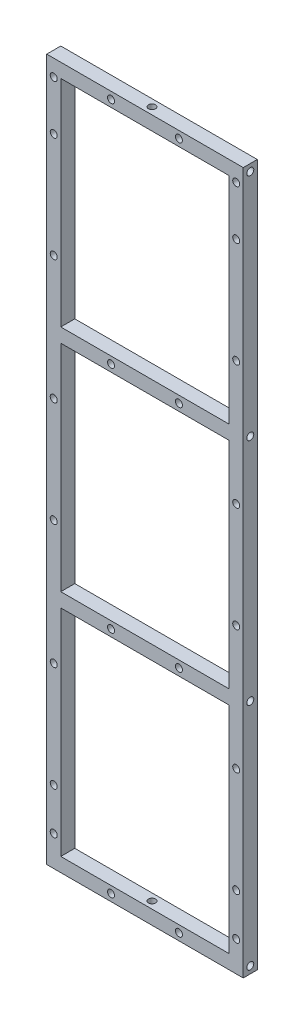
from build123d import *

# Parameters (mm, degrees)
SKETCH1_W           = 84
SKETCH1_H           = 300
SKETCH1_W_2         = 72
SKETCH1_H_2         = 92
BOSS_EXTRUDE1_DEPTH = 6
SKETCH2_R           = 1.5
CUT_EXTRUDE1_DEPTH  = 10
SKETCH3_R           = 1.5
CUT_EXTRUDE2_DEPTH  = 10
SKETCH4_R           = 1.5
CUT_EXTRUDE3_DEPTH  = 10
SKETCH5_R           = 1.5
CUT_EXTRUDE4_DEPTH  = 10


with BuildPart() as part:
    # Sketch1 → Boss-Extrude1 (new body)
    with BuildSketch(Plane.XY):
        Rectangle(SKETCH1_W, SKETCH1_H)
        with Locations((0, 98)):
            Rectangle(SKETCH1_W_2, SKETCH1_H_2, mode=Mode.SUBTRACT)
        with Locations((0, -98)):
            Rectangle(SKETCH1_W_2, SKETCH1_H_2, mode=Mode.SUBTRACT)
        Rectangle(SKETCH1_W_2, SKETCH1_H_2, mode=Mode.SUBTRACT)
    extrude(amount=BOSS_EXTRUDE1_DEPTH)

    # Sketch2 → Cut-Extrude1 (cut)
    with BuildSketch(Plane(origin=(42, 0, 0), x_dir=(0, 0, -1), z_dir=(1, 0, 0))):
        with Locations((-3, 147)):
            Circle(SKETCH2_R)
        with Locations((-3, 49)):
            Circle(SKETCH2_R)
        with Locations((-3, -49)):
            Circle(SKETCH2_R)
        with Locations((-3, -147)):
            Circle(SKETCH2_R)
    cut_extrude1 = extrude(amount=-CUT_EXTRUDE1_DEPTH, mode=Mode.SUBTRACT)

    # Mirror1: Cut-Extrude1 across plane
    add(cut_extrude1.mirror(Plane(origin=(0, 0, 0), x_dir=(0, 0, 1), z_dir=(1, 0, 0))), mode=Mode.SUBTRACT)

    # Sketch3 → Cut-Extrude2 (cut)
    with BuildSketch(Plane.XY.offset(6)):
        with Locations((-39, 143)):
            Circle(SKETCH3_R)
        with Locations((39, 143)):
            Circle(SKETCH3_R)
        with Locations((39, -137)):
            Circle(SKETCH3_R)
        with Locations((-39, -137)):
            Circle(SKETCH3_R)
    extrude(amount=-CUT_EXTRUDE2_DEPTH, mode=Mode.SUBTRACT)

    # Sketch4 → Cut-Extrude3 (cut)
    with BuildSketch(Plane.XY.offset(6)):
        with Locations((-14.5, 147)):
            Circle(SKETCH4_R)
        with Locations((14.5, 147)):
            Circle(SKETCH4_R)
        with Locations((14.5, 49)):
            Circle(SKETCH4_R)
        with Locations((-14.5, 49)):
            Circle(SKETCH4_R)
        with Locations((14.5, -49)):
            Circle(SKETCH4_R)
        with Locations((-14.5, -49)):
            Circle(SKETCH4_R)
        with Locations((14.5, -147)):
            Circle(SKETCH4_R)
        with Locations((-14.5, -147)):
            Circle(SKETCH4_R)
        with Locations((-39, 122)):
            Circle(SKETCH4_R)
        with Locations((-39, 77)):
            Circle(SKETCH4_R)
        with Locations((39, 122)):
            Circle(SKETCH4_R)
        with Locations((39, 77)):
            Circle(SKETCH4_R)
        with Locations((39, 24)):
            Circle(SKETCH4_R)
        with Locations((39, -21)):
            Circle(SKETCH4_R)
        with Locations((39, -74)):
            Circle(SKETCH4_R)
        with Locations((39, -119)):
            Circle(SKETCH4_R)
        with Locations((-39, 24)):
            Circle(SKETCH4_R)
        with Locations((-39, -21)):
            Circle(SKETCH4_R)
        with Locations((-39, -74)):
            Circle(SKETCH4_R)
        with Locations((-39, -119)):
            Circle(SKETCH4_R)
    extrude(amount=-CUT_EXTRUDE3_DEPTH, mode=Mode.SUBTRACT)

    # Sketch5 → Cut-Extrude4 (cut)
    with BuildSketch(Plane(origin=(0, 150, 0), x_dir=(1, 0, 0), z_dir=(0, 1, 0))):
        with Locations((0, -3)):
            Circle(SKETCH5_R)
    cut_extrude4 = extrude(amount=-CUT_EXTRUDE4_DEPTH, mode=Mode.SUBTRACT)

    # Mirror2: Cut-Extrude4 across plane
    add(cut_extrude4.mirror(Plane.ZX), mode=Mode.SUBTRACT)


solid = part.part
